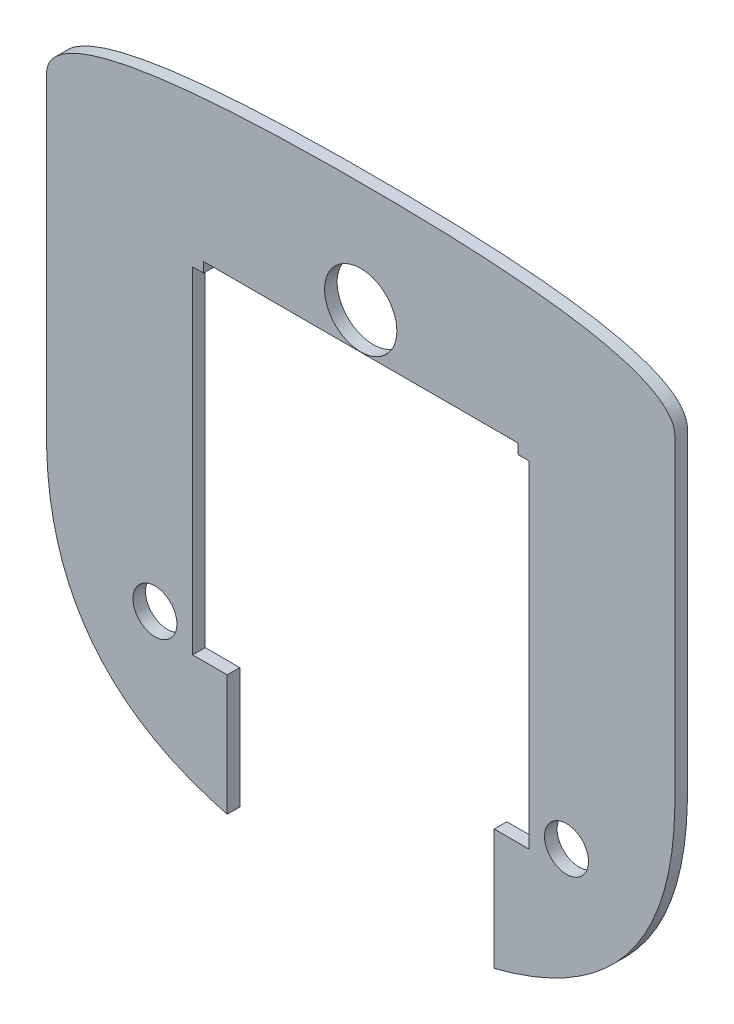
from build123d import *

# Parameters (mm, degrees)
SKETCH1_R           = 11.5
SKETCH1_R_2         = 7
BOSS_EXTRUDE1_DEPTH = 4


with BuildPart() as part:
    # Sketch1 → Boss-Extrude1 (new body)
    with BuildSketch(Plane.XY.offset(804.734016148)):
        with BuildLine():
            Line((53.5, -36.887752409), (53.5, 70.112247591))
            Line((53.5, 70.112247591), (50, 70.112247591))
            Line((50, 70.112247591), (50, 73.287247591))
            Line((50, 73.287247591), (-50, 73.287247591))
            Line((-50, 73.287247591), (-50, 70.112247591))
            Line((-50, 70.112247591), (-53.5, 70.112247591))
            Line((-53.5, 70.112247591), (-53.5, -36.887752409))
            Line((-53.5, -36.887752409), (-42.5, -36.887752409))
            Line((-42.5, -36.887752409), (-42.5, -75.326207242))
            add(Edge.make_bspline(
                [(42.5, -75.326207249), (46.393406115, -74.333836082), (53.153405442, -72.242903458), (62.448555794, -68.199662371), (70.388362923, -63.616097856), (77.672911322, -58.036890377), (84.079370251, -51.464792085), (89.426142839, -44.003661649), (93.617740163, -35.841010463), (96.670778645, -27.192812979), (98.681399022, -18.24962288), (99.782324246, -9.153462628), (100, -3.050935363), (100, 24.999993018), (100, 58.333344336), (100, 91.666670265), (100, 100.554134115), (99.883481515, 101.662960707), (99.344039, 103.246408998), (98.497409161, 104.684676382), (97.062215668, 106.384264679), (94.888767651, 108.125798269), (91.997603375, 109.778160622), (88.955073453, 111.127120448), (85.82620432, 112.255214282), (82.642451633, 113.216883316), (79.422720976, 114.047933739), (76.177735279, 114.773888431), (72.91469425, 115.412911755), (69.638263064, 115.978992886), (65.256094458, 116.650126372), (59.759104977, 117.354360164), (53.143709601, 118.031993299), (46.516059908, 118.575062127), (37.668279806, 119.150076874), (26.595455091, 119.635916595), (13.299238768, 119.94140529), (4.433070948, 120), (-4.43307135, 120), (-13.299239523, 119.941405281), (-26.595456105, 119.635916563), (-37.668280675, 119.150076827), (-46.516060603, 118.575062076), (-53.143710113, 118.031993251), (-59.759105303, 117.354360125), (-65.256094625, 116.650126347), (-69.638263116, 115.978992877), (-72.914694222, 115.41291176), (-76.17773518, 114.773888451), (-79.422720819, 114.047933776), (-82.642451431, 113.216883372), (-85.826204089, 112.255214357), (-88.955073212, 111.127120544), (-91.997603146, 109.778160737), (-94.888767459, 108.125798398), (-97.06221553, 106.384264812), (-98.497409078, 104.6846765), (-99.344038958, 103.246409096), (-99.883481507, 101.662960758), (-100, 100.554134142), (-100, 91.666670581), (-100, 58.333345048), (-100, 24.999997732), (-100, -3.050935372), (-99.78232424, -9.153462759), (-98.681399, -18.249622998), (-96.67077862, -27.192813059), (-93.617740169, -35.841010433), (-89.426142924, -44.003661495), (-84.079370472, -51.464791807), (-77.672911721, -58.036890011), (-70.388363529, -63.616097446), (-62.44855659, -68.199661963), (-53.153406092, -72.242903244), (-46.393406464, -74.333835993), (-42.5, -75.326207242)],
                knots=[0.711515291, 0.711515291, 0.711515291, 0.711515291, 0.728593312, 0.741563395, 0.754533479, 0.767503562, 0.780473646, 0.79344373, 0.806413813, 0.819383897, 0.83235398, 0.845324064, 0.858294148, 0.858294148, 0.964573537, 1, 1, 1.002355824, 1.004711648, 1.007067472, 1.009423297, 1.014134945, 1.018846593, 1.023558241, 1.02826989, 1.032981538, 1.037693186, 1.042404834, 1.047116483, 1.051828131, 1.056539779, 1.065963076, 1.075386372, 1.084809669, 1.094232965, 1.113079558, 1.131926151, 1.150772744, 1.150772744, 1.169619384, 1.188466024, 1.207312664, 1.216735984, 1.226159304, 1.235582624, 1.245005944, 1.249717604, 1.254429264, 1.259140924, 1.263852584, 1.268564244, 1.273275904, 1.277987564, 1.282699224, 1.287410884, 1.292122544, 1.294478375, 1.296834205, 1.299190035, 1.301545865, 1.301545865, 1.336972328, 1.443251717, 1.443251717, 1.456221785, 1.469191854, 1.482161922, 1.49513199, 1.508102059, 1.521072127, 1.534042195, 1.547012264, 1.559982332, 1.5729524, 1.590030402, 1.590030402, 1.590030402, 1.590030402], degree=3))
            Line((42.5, -75.326207249), (42.5, -36.887752409))
            Line((42.5, -36.887752409), (53.5, -36.887752409))
        make_face()
        with Locations((0, 84.887247591)):
            Circle(SKETCH1_R, mode=Mode.SUBTRACT)
        with Locations((65.5, -30.887752409)):
            Circle(SKETCH1_R_2, mode=Mode.SUBTRACT)
        with Locations((-65.5, -30.887752409)):
            Circle(SKETCH1_R_2, mode=Mode.SUBTRACT)
    extrude(amount=-BOSS_EXTRUDE1_DEPTH)


solid = part.part
